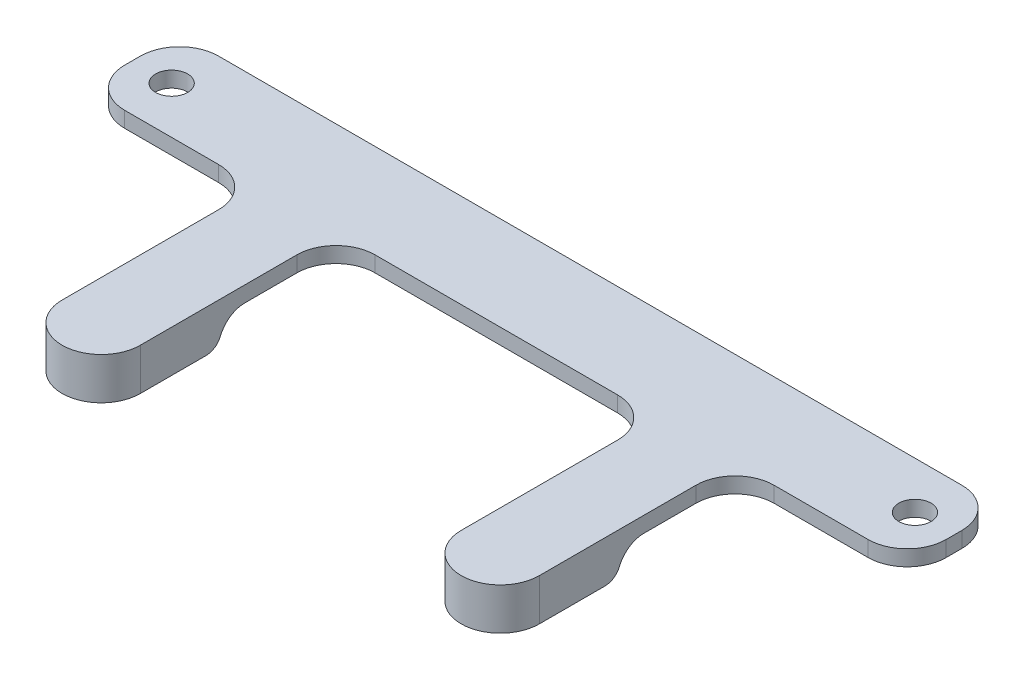
from build123d import *

# Parameters (mm, degrees)
BOSS_EXTRUDE1_DEPTH  = 2
SKETCH3_R            = 2.05
CUT_EXTRUDE1_DEPTH   = 64.688696014
FILLET1_R            = 5
BOSS_EXTRUDE2_DEPTH  = 5.35
FILLET2_R            = 3.36
FILLET3_R            = 2
FILLET2_OF_MIRROR1_R = 3.36
FILLET3_OF_MIRROR1_R = 2


# Some blends are built 0.0001 mm under size
with BuildPart() as part:
    # Sketch1 → Boss-Extrude1 (new body)
    with BuildSketch(Plane(origin=(0, 0, 0), x_dir=(1, 0, 0), z_dir=(0, 1, 0))):
        Polygon((-52.5, 6), (52.5, 6), (52.5, -6), (30.5, -6), (30.5, -36), (20.5, -36), (20.5, -6), (-20.5, -6), (-20.5, -36), (-30.5, -36), (-30.5, -6), (-52.5, -6), align=None)
    extrude(amount=BOSS_EXTRUDE1_DEPTH)

    # Sketch3 → Cut-Extrude1 (cut, through all)
    with BuildSketch(Plane(origin=(0, 2, 0), x_dir=(1, 0, 0), z_dir=(0, 1, 0))):
        with Locations(Location((-47.5, 0, 0), (0, 0, 270))):
            Circle(SKETCH3_R)
        with Locations(Location((47.5, 0, 0), (0, 0, 90))):
            Circle(SKETCH3_R)
    extrude(amount=-CUT_EXTRUDE1_DEPTH, mode=Mode.SUBTRACT)

    # Fillet1
    fillet1_edges = [part.edges().sort_by_distance(p)[0] for p in [
        (52.5, 1, -6),
        (52.5, 1, 6),
        (20.5, 1, 6),
        (30.5, 1, 6),
        (30.5, 1, 36),
        (20.5, 1, 36),
        (-30.5, 1, 36),
        (-20.5, 1, 36),
        (-20.5, 1, 6),
        (-30.5, 1, 6),
        (-52.5, 1, -6),
        (-52.5, 1, 6),
    ]]
    fillet(fillet1_edges, radius=FILLET1_R - 0.0001)  # a hair under: the kernel refuses the full size

    # Sketch4 → Boss-Extrude2 (add)
    with BuildSketch(Plane(origin=(0, 2, 0), x_dir=(1, 0, 0), z_dir=(0, 1, 0))):
        with BuildLine():
            Line((-20.5, -31), (-20.5, -21))
            Line((-20.5, -21), (-30.5, -21))
            Line((-30.5, -21), (-30.5, -31))
            ThreePointArc((-30.5, -31), (-29.035533906, -34.535533906), (-25.5, -36))
            ThreePointArc((-25.5, -36), (-21.964466094, -34.535533906), (-20.5, -31))
        make_face()
    boss_extrude2 = extrude(amount=-BOSS_EXTRUDE2_DEPTH)

    # Fillet2
    # the kernel refuses this fillet: 3.36 mm, written as the material it adds along each edge
    with BuildSketch(Plane(origin=(-30.5, 0, 21), x_dir=(0, -1, 0), z_dir=(1, 0, 0))) as fillet2_piece_1_section:
        with BuildLine():
            CenterArc((FILLET2_R, FILLET2_R), FILLET2_R, 180, 90)
            Line((0, FILLET2_R), (0, 0))
            Line((0, 0), (FILLET2_R, 0))
        make_face()
    fillet2_piece_1 = extrude(amount=10, mode=Mode.PRIVATE)
    fillet2_piece_1 = split(fillet2_piece_1, bisect_by=Plane(origin=(-25.5, -3.35, 20.239126953), z_dir=(0, 1, 0)), keep=Keep.TOP, mode=Mode.PRIVATE)
    add(fillet2_piece_1)

    # Fillet3
    fillet3_edges = [part.edges().sort_by_distance(p)[0] for p in [
        (-25.5, -3.35, 20.999985119),
    ]]
    fillet(fillet3_edges, radius=FILLET3_R)

    # Mirror1: Boss-Extrude2 across plane
    add(boss_extrude2.mirror(Plane(origin=(0, 0, 0), x_dir=(0, 0, 1), z_dir=(1, 0, 0))))

    # Fillet2 of Mirror1
    # the kernel refuses this fillet: 3.36 mm, written as the material it adds along each edge
    with BuildSketch(Plane(origin=(30.5, 0, 21), x_dir=(0, -1, 0), z_dir=(-1, 0, 0))) as fillet2_of_mirror1_piece_1_section:
        with BuildLine():
            CenterArc((FILLET2_OF_MIRROR1_R, -FILLET2_OF_MIRROR1_R), FILLET2_OF_MIRROR1_R, 90, 90)
            Line((0, -FILLET2_OF_MIRROR1_R), (0, 0))
            Line((0, 0), (FILLET2_OF_MIRROR1_R, 0))
        make_face()
    fillet2_of_mirror1_piece_1 = extrude(amount=10, mode=Mode.PRIVATE)
    fillet2_of_mirror1_piece_1 = split(fillet2_of_mirror1_piece_1, bisect_by=Plane(origin=(25.5, -3.35, 20.239126953), z_dir=(0, 1, 0)), keep=Keep.TOP, mode=Mode.PRIVATE)
    add(fillet2_of_mirror1_piece_1)

    # Fillet3 of Mirror1
    fillet3_of_mirror1_edges = [part.edges().sort_by_distance(p)[0] for p in [
        (25.5, -3.35, 20.999985119),
    ]]
    fillet(fillet3_of_mirror1_edges, radius=FILLET3_OF_MIRROR1_R)


solid = part.part
